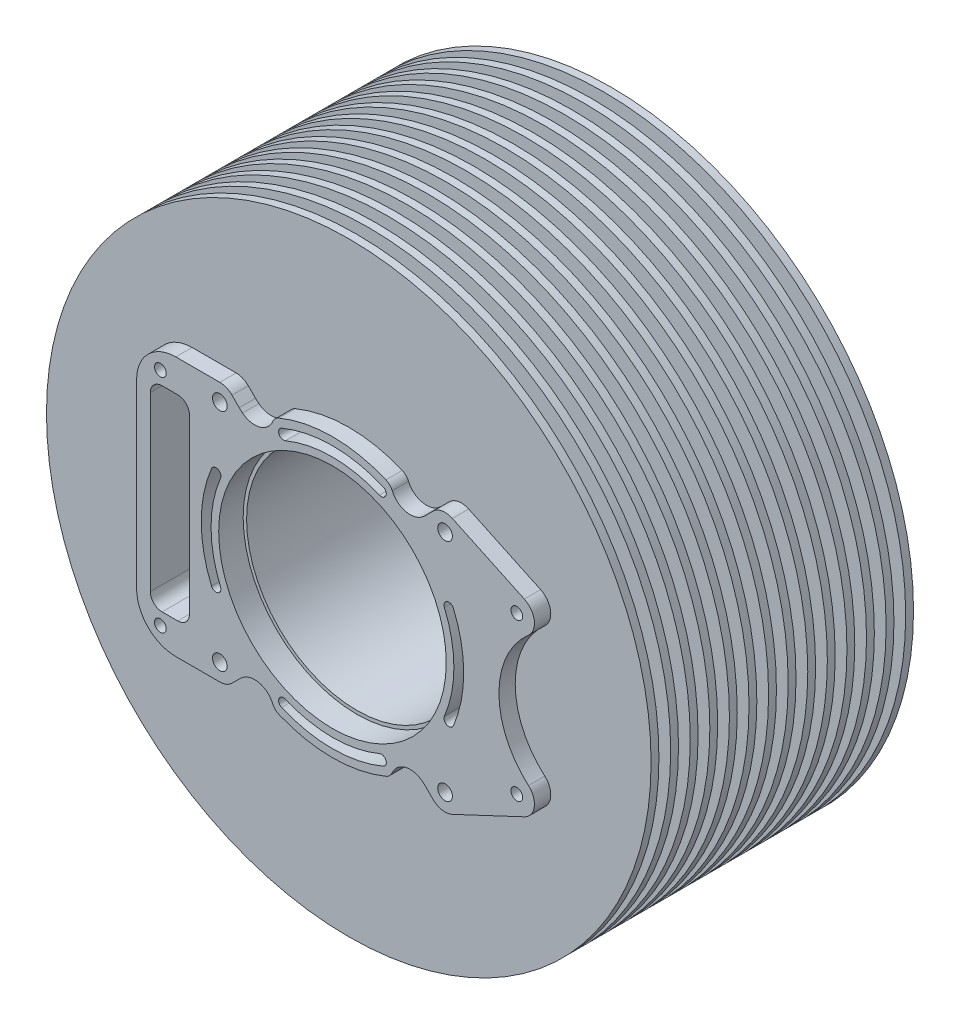
from build123d import *

# Parameters (mm, degrees)
SKETCH1_R               = 3.75
SKETCH1_R_2             = 56.35
BOSS_EXTRUDE1_DEPTH     = 142.33
SKETCH2_R               = 58.1
CUT_EXTRUDE1_DEPTH      = 12.5
BOSS_EXTRUDE2_DEPTH     = 142.33
SKETCH5_R               = 154.357898139
BOSS_EXTRUDE3_DEPTH     = 4
LPATTERN1_COUNT         = 14
LPATTERN1_PITCH         = 10
CUT_EXTRUDE5_DEPTH      = 289.931887
CUT_EXTRUDE5_DEPTH_BACK = 289.931887
BOSS_EXTRUDE5_START     = -40
SKETCH9_R               = 3
BOSS_EXTRUDE5_DEPTH     = 40
SKETCH10_R              = 3
CUT_EXTRUDE6_DEPTH      = 40


with BuildPart() as part:
    # Sketch1 → Boss-Extrude1 (new body)
    with BuildSketch(Plane.XY):
        with BuildLine():
            Line((-91.753874008, 59.998242678), (-95.442815665, 63.687184335))
            ThreePointArc((-95.442815665, 63.687184335), (-107.817184335, 63.687184335), (-107.817184335, 51.312815665))
            Line((-107.817184335, 51.312815665), (-104.128242678, 47.623874008))
            ThreePointArc((-104.128242678, 47.623874008), (-103.345720488, 46.795437687), (-102.611652979, 45.923776853))
            ThreePointArc((-102.611652979, 45.923776853), (-100.744409144, 37.258208079), (-106.496630865, 30.513534107))
            ThreePointArc((-106.496630865, 30.513534107), (-108.395205375, 29.219955345), (-109.668461538, 27.307692308))
            ThreePointArc((-109.668461538, 27.307692308), (-115.13, 0), (-109.668461538, -27.307692308))
            ThreePointArc((-109.668461538, -27.307692308), (-108.395205375, -29.219955345), (-106.496630865, -30.513534107))
            ThreePointArc((-106.496630865, -30.513534107), (-100.744409144, -37.258208079), (-102.611652979, -45.923776853))
            ThreePointArc((-102.611652979, -45.923776853), (-103.345720488, -46.795437687), (-104.128242678, -47.623874008))
            Line((-104.128242678, -47.623874008), (-107.817184335, -51.312815665))
            ThreePointArc((-107.817184335, -51.312815665), (-107.817184335, -63.687184335), (-95.442815665, -63.687184335))
            Line((-95.442815665, -63.687184335), (-91.753874008, -59.998242678))
            ThreePointArc((-91.753874008, -59.998242678), (-90.925437687, -59.215720488), (-90.053776853, -58.481652979))
            ThreePointArc((-90.053776853, -58.481652979), (-81.388208079, -56.614409144), (-74.643534107, -62.366630865))
            ThreePointArc((-74.643534107, -62.366630865), (-73.349955345, -64.265205375), (-71.437692308, -65.538461538))
            ThreePointArc((-71.437692308, -65.538461538), (-44.13, -71), (-16.822307692, -65.538461538))
            ThreePointArc((-16.822307692, -65.538461538), (-14.910044655, -64.265205375), (-13.616465893, -62.366630865))
            ThreePointArc((-13.616465893, -62.366630865), (-6.871791921, -56.614409144), (1.793776853, -58.481652979))
            ThreePointArc((1.793776853, -58.481652979), (2.665437687, -59.215720488), (3.493874008, -59.998242678))
            Line((3.493874008, -59.998242678), (7.182815665, -63.687184335))
            ThreePointArc((7.182815665, -63.687184335), (19.557184335, -63.687184335), (19.557184335, -51.312815665))
            Line((19.557184335, -51.312815665), (15.868242678, -47.623874008))
            ThreePointArc((15.868242678, -47.623874008), (15.085720488, -46.795437687), (14.351652979, -45.923776853))
            ThreePointArc((14.351652979, -45.923776853), (12.484409144, -37.258208079), (18.236630865, -30.513534107))
            ThreePointArc((18.236630865, -30.513534107), (20.135205375, -29.219955345), (21.408461538, -27.307692308))
            ThreePointArc((21.408461538, -27.307692308), (26.87, 0), (21.408461538, 27.307692308))
            ThreePointArc((21.408461538, 27.307692308), (20.135205375, 29.219955345), (18.236630865, 30.513534107))
            ThreePointArc((18.236630865, 30.513534107), (12.484409144, 37.258208079), (14.351652979, 45.923776853))
            ThreePointArc((14.351652979, 45.923776853), (15.085720488, 46.795437687), (15.868242678, 47.623874008))
            Line((15.868242678, 47.623874008), (19.557184335, 51.312815665))
            ThreePointArc((19.557184335, 51.312815665), (19.557184335, 63.687184335), (7.182815665, 63.687184335))
            Line((7.182815665, 63.687184335), (3.493874008, 59.998242678))
            ThreePointArc((3.493874008, 59.998242678), (2.665437687, 59.215720488), (1.793776853, 58.481652979))
            ThreePointArc((1.793776853, 58.481652979), (-6.871791921, 56.614409144), (-13.616465893, 62.366630865))
            ThreePointArc((-13.616465893, 62.366630865), (-14.910044655, 64.265205375), (-16.822307692, 65.538461538))
            ThreePointArc((-16.822307692, 65.538461538), (-44.13, 71), (-71.437692308, 65.538461538))
            ThreePointArc((-71.437692308, 65.538461538), (-73.349955345, 64.265205375), (-74.643534107, 62.366630865))
            ThreePointArc((-74.643534107, 62.366630865), (-81.388208079, 56.614409144), (-90.053776853, 58.481652979))
            ThreePointArc((-90.053776853, 58.481652979), (-90.925437687, 59.215720488), (-91.753874008, 59.998242678))
        make_face()
        with Locations((-101.63, -57.5)):
            Circle(SKETCH1_R, mode=Mode.SUBTRACT)
        with Locations((13.37, -57.5)):
            Circle(SKETCH1_R, mode=Mode.SUBTRACT)
        with Locations((13.37, 57.5)):
            Circle(SKETCH1_R, mode=Mode.SUBTRACT)
        with Locations((-44.13, 0)):
            Circle(SKETCH1_R_2, mode=Mode.SUBTRACT)
        with Locations((-101.63, 57.5)):
            Circle(SKETCH1_R, mode=Mode.SUBTRACT)
    extrude(amount=BOSS_EXTRUDE1_DEPTH)

    # Sketch2 → Cut-Extrude1 (cut)
    with BuildSketch(Plane.XY.offset(142.33)):
        with Locations((-44.13, 0)):
            Circle(SKETCH2_R)
    extrude(amount=-CUT_EXTRUDE1_DEPTH, mode=Mode.SUBTRACT)

    # Sketch4 → Boss-Extrude2 (add)
    with BuildSketch(Plane.XY):
        with BuildLine():
            Line((-104.128242678, -47.623874008), (-107.817184335, -51.312815665))
            ThreePointArc((-107.817184335, -51.312815665), (-109.713945909, -60.848480033), (-101.63, -66.25))
            Line((-101.63, -66.25), (-124.13, -66.25))
            ThreePointArc((-124.13, -66.25), (-138.272135624, -60.392135624), (-144.13, -46.25))
            Line((-144.13, -46.25), (-144.13, 46.25))
            ThreePointArc((-144.13, 46.25), (-138.272135624, 60.392135624), (-124.13, 66.25))
            Line((-124.13, 66.25), (-101.63, 66.25))
            ThreePointArc((-101.63, 66.25), (-109.713945909, 60.848480033), (-107.817184335, 51.312815665))
            Line((-107.817184335, 51.312815665), (-104.128242678, 47.623874008))
            ThreePointArc((-104.128242678, 47.623874008), (-103.345720488, 46.795437687), (-102.611652979, 45.923776853))
            ThreePointArc((-102.611652979, 45.923776853), (-100.744409144, 37.258208079), (-106.496630865, 30.513534107))
            ThreePointArc((-106.496630865, 30.513534107), (-108.395205375, 29.219955345), (-109.668461538, 27.307692308))
            ThreePointArc((-109.668461538, 27.307692308), (-115.13, 0), (-109.668461538, -27.307692308))
            ThreePointArc((-109.668461538, -27.307692308), (-108.395205375, -29.219955345), (-106.496630865, -30.513534107))
            ThreePointArc((-106.496630865, -30.513534107), (-100.744409144, -37.258208079), (-102.611652979, -45.923776853))
            ThreePointArc((-102.611652979, -45.923776853), (-103.345720488, -46.795437687), (-104.128242678, -47.623874008))
        make_face()
        with BuildLine():
            Line((-131.13, 50), (-123.13, 50))
            ThreePointArc((-123.13, 50), (-118.887359313, 48.242640687), (-117.13, 44))
            Line((-117.13, 44), (-117.13, -44))
            ThreePointArc((-117.13, -44), (-118.887359313, -48.242640687), (-123.13, -50))
            Line((-123.13, -50), (-131.13, -50))
            ThreePointArc((-131.13, -50), (-135.372640687, -48.242640687), (-137.13, -44))
            Line((-137.13, -44), (-137.13, 44))
            ThreePointArc((-137.13, 44), (-135.372640687, 48.242640687), (-131.13, 50))
        make_face(mode=Mode.SUBTRACT)
    extrude(amount=BOSS_EXTRUDE2_DEPTH)

    # Sketch5 → Boss-Extrude3 (add)
    with BuildSketch(Plane.XY):
        with Locations((-44.13, 0)):
            Circle(SKETCH5_R)
        with BuildLine():
            Line((-124.13, 66.25), (-101.63, 66.25))
            ThreePointArc((-101.63, 66.25), (-98.281519967, 65.583945909), (-95.442815665, 63.687184335))
            Line((-95.442815665, 63.687184335), (-91.753874008, 59.998242678))
            ThreePointArc((-91.753874008, 59.998242678), (-90.925437687, 59.215720488), (-90.053776853, 58.481652979))
            ThreePointArc((-90.053776853, 58.481652979), (-81.388208079, 56.614409144), (-74.643534107, 62.366630865))
            ThreePointArc((-74.643534107, 62.366630865), (-73.349955345, 64.265205375), (-71.437692308, 65.538461538))
            ThreePointArc((-71.437692308, 65.538461538), (-44.13, 71), (-16.822307692, 65.538461538))
            ThreePointArc((-16.822307692, 65.538461538), (-14.910044655, 64.265205375), (-13.616465893, 62.366630865))
            ThreePointArc((-13.616465893, 62.366630865), (-6.871791921, 56.614409144), (1.793776853, 58.481652979))
            ThreePointArc((1.793776853, 58.481652979), (2.665437687, 59.215720488), (3.493874008, 59.998242678))
            Line((3.493874008, 59.998242678), (7.182815665, 63.687184335))
            ThreePointArc((7.182815665, 63.687184335), (19.557184335, 63.687184335), (19.557184335, 51.312815665))
            Line((19.557184335, 51.312815665), (15.868242678, 47.623874008))
            ThreePointArc((15.868242678, 47.623874008), (15.085720488, 46.795437687), (14.351652979, 45.923776853))
            ThreePointArc((14.351652979, 45.923776853), (12.484409144, 37.258208079), (18.236630865, 30.513534107))
            ThreePointArc((18.236630865, 30.513534107), (20.135205375, 29.219955345), (21.408461538, 27.307692308))
            ThreePointArc((21.408461538, 27.307692308), (26.87, 0), (21.408461538, -27.307692308))
            ThreePointArc((21.408461538, -27.307692308), (20.135205375, -29.219955345), (18.236630865, -30.513534107))
            ThreePointArc((18.236630865, -30.513534107), (12.484409144, -37.258208079), (14.351652979, -45.923776853))
            ThreePointArc((14.351652979, -45.923776853), (15.085720488, -46.795437687), (15.868242678, -47.623874008))
            Line((15.868242678, -47.623874008), (19.557184335, -51.312815665))
            ThreePointArc((19.557184335, -51.312815665), (19.557184335, -63.687184335), (7.182815665, -63.687184335))
            Line((7.182815665, -63.687184335), (3.493874008, -59.998242678))
            ThreePointArc((3.493874008, -59.998242678), (2.665437687, -59.215720488), (1.793776853, -58.481652979))
            ThreePointArc((1.793776853, -58.481652979), (-6.871791921, -56.614409144), (-13.616465893, -62.366630865))
            ThreePointArc((-13.616465893, -62.366630865), (-14.910044655, -64.265205375), (-16.822307692, -65.538461538))
            ThreePointArc((-16.822307692, -65.538461538), (-44.13, -71), (-71.437692308, -65.538461538))
            ThreePointArc((-71.437692308, -65.538461538), (-73.349955345, -64.265205375), (-74.643534107, -62.366630865))
            ThreePointArc((-74.643534107, -62.366630865), (-81.388208079, -56.614409144), (-90.053776853, -58.481652979))
            ThreePointArc((-90.053776853, -58.481652979), (-90.925437687, -59.215720488), (-91.753874008, -59.998242678))
            Line((-91.753874008, -59.998242678), (-95.442815665, -63.687184335))
            ThreePointArc((-95.442815665, -63.687184335), (-98.281519967, -65.583945909), (-101.63, -66.25))
            Line((-101.63, -66.25), (-124.13, -66.25))
            ThreePointArc((-124.13, -66.25), (-138.272135624, -60.392135624), (-144.13, -46.25))
            Line((-144.13, -46.25), (-144.13, 46.25))
            ThreePointArc((-144.13, 46.25), (-138.272135624, 60.392135624), (-124.13, 66.25))
        make_face(mode=Mode.SUBTRACT)
    boss_extrude3 = extrude(amount=BOSS_EXTRUDE3_DEPTH)

    # LPattern1: Boss-Extrude3 ×14
    with Locations(*[(0, 0, i * LPATTERN1_PITCH) for i in range(1, LPATTERN1_COUNT)]):
        add(boss_extrude3)

    # Sketch6 → Cut-Extrude5 (cut, two sides: drawn at the far end of the back side and taken through both)
    with BuildSketch(Plane.XY.offset(142.33).offset(-CUT_EXTRUDE5_DEPTH_BACK)):
        with BuildLine():
            ThreePointArc((13.023395931, 24.031007752), (17.87, 0), (13.023395931, -24.031007752))
            ThreePointArc((13.023395931, -24.031007752), (14.358976099, -27.304572417), (17.632540764, -25.968992248))
            ThreePointArc((17.632540764, -25.968992248), (22.87, 0), (17.632540764, 25.968992248))
            ThreePointArc((17.632540764, 25.968992248), (14.358976099, 27.304572417), (13.023395931, 24.031007752))
        make_face()
        with BuildLine():
            ThreePointArc((-68.161007752, 57.153395931), (-44.13, 62), (-20.098992248, 57.153395931))
            ThreePointArc((-20.098992248, 57.153395931), (-16.825427583, 58.488976099), (-18.161007752, 61.762540764))
            ThreePointArc((-18.161007752, 61.762540764), (-44.13, 67), (-70.098992248, 61.762540764))
            ThreePointArc((-70.098992248, 61.762540764), (-71.434572417, 58.488976099), (-68.161007752, 57.153395931))
        make_face()
        with BuildLine():
            ThreePointArc((-18.161007752, -61.762540764), (-16.825427583, -58.488976099), (-20.098992248, -57.153395931))
            ThreePointArc((-20.098992248, -57.153395931), (-44.13, -62), (-68.161007752, -57.153395931))
            ThreePointArc((-68.161007752, -57.153395931), (-71.434572417, -58.488976099), (-70.098992248, -61.762540764))
            ThreePointArc((-70.098992248, -61.762540764), (-44.13, -67), (-18.161007752, -61.762540764))
        make_face()
        with BuildLine():
            ThreePointArc((-101.283395931, -24.031007752), (-106.13, 0), (-101.283395931, 24.031007752))
            ThreePointArc((-101.283395931, 24.031007752), (-102.618976099, 27.304572417), (-105.892540764, 25.968992248))
            ThreePointArc((-105.892540764, 25.968992248), (-111.13, 0), (-105.892540764, -25.968992248))
            ThreePointArc((-105.892540764, -25.968992248), (-102.618976099, -27.304572417), (-101.283395931, -24.031007752))
        make_face()
    extrude(amount=CUT_EXTRUDE5_DEPTH + CUT_EXTRUDE5_DEPTH_BACK, mode=Mode.SUBTRACT)

    # Sketch9 → Boss-Extrude5 (add)
    with BuildSketch(Plane.XY.offset(142.33).offset(BOSS_EXTRUDE5_START)):
        with BuildLine():
            Line((53.829641932, 48.144559084), (17.093262989, 65.418321332))
            ThreePointArc((17.093262989, 65.418321332), (21.98948746, 59.005634725), (19.557184335, 51.312815665))
            Line((19.557184335, 51.312815665), (15.868242678, 47.623874008))
            ThreePointArc((15.868242678, 47.623874008), (15.085720488, 46.795437687), (14.351652979, 45.923776853))
            ThreePointArc((14.351652979, 45.923776853), (12.484409144, 37.258208079), (18.236630865, 30.513534107))
            ThreePointArc((18.236630865, 30.513534107), (20.135205375, 29.219955345), (21.408461538, 27.307692308))
            ThreePointArc((21.408461538, 27.307692308), (26.87, 0), (21.408461538, -27.307692308))
            ThreePointArc((21.408461538, -27.307692308), (20.135205375, -29.219955345), (18.236630865, -30.513534107))
            ThreePointArc((18.236630865, -30.513534107), (12.484409144, -37.258208079), (14.351652979, -45.923776853))
            ThreePointArc((14.351652979, -45.923776853), (15.085720488, -46.795437687), (15.868242678, -47.623874008))
            Line((15.868242678, -47.623874008), (19.557184335, -51.312815665))
            ThreePointArc((19.557184335, -51.312815665), (21.98948746, -59.005634725), (17.093262989, -65.418321332))
            Line((17.093262989, -65.418321332), (53.829641932, -48.144559084))
            ThreePointArc((53.829641932, -48.144559084), (58.912384079, -41.252760966), (55.926541471, -33.226809748))
            ThreePointArc((55.926541471, -33.226809748), (40.849270936, 0), (55.926541471, 33.226809748))
            ThreePointArc((55.926541471, 33.226809748), (58.912384079, 41.252760966), (53.829641932, 48.144559084))
        make_face()
        with Locations((50, 40)):
            Circle(SKETCH9_R, mode=Mode.SUBTRACT)
        with Locations((50, -40)):
            Circle(SKETCH9_R, mode=Mode.SUBTRACT)
    extrude(amount=BOSS_EXTRUDE5_DEPTH)

    # Sketch10 → Cut-Extrude6 (cut)
    with BuildSketch(Plane.XY.offset(142.33)):
        with Locations((-132, 56.5)):
            Circle(SKETCH10_R)
        with Locations((-132, -56.5)):
            Circle(SKETCH10_R)
    extrude(amount=-CUT_EXTRUDE6_DEPTH, mode=Mode.SUBTRACT)


solid = part.part
